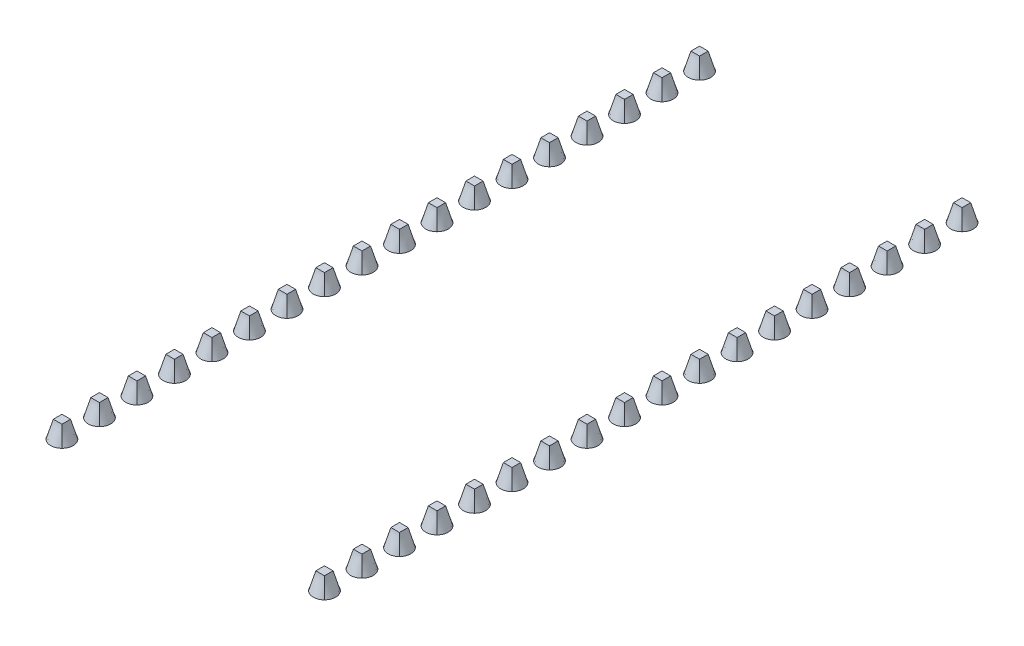
from build123d import *


with BuildPart() as part:
    # Sketch1 for Loft1 → Loft1 section 0
    with BuildSketch(Plane(origin=(0, 0, 0), x_dir=(1, 0, 0), z_dir=(0, 1, 0))):
        with BuildLine():
            # circular arc as an exact rational Bezier (weights 1, cos(half-angle), 1)
            Bezier((-8.351184633, -21.051184633), (-8.89, -20.512369265), (-9.428815367, -21.051184633), weights=[1, 0.70710678, 1])
            Bezier((-9.428815367, -21.051184633), (-9.967630735, -21.59), (-9.428815367, -22.128815367), weights=[1, 0.70710678, 1])
            Bezier((-9.428815367, -22.128815367), (-8.89, -22.667630735), (-8.351184633, -22.128815367), weights=[1, 0.70710678, 1])
            Bezier((-8.351184633, -22.128815367), (-7.812369265, -21.59), (-8.351184633, -21.051184633), weights=[1, 0.70710678, 1])
        make_face()
    # Sketch2 → Loft1 section 1
    with BuildSketch(Plane(origin=(0, 1.1684, 0), x_dir=(1, 0, 0), z_dir=(0, 1, 0))):
        with BuildLine():
            Line((-8.5979, -21.2979), (-9.1821, -21.2979))
            Line((-9.1821, -21.2979), (-9.1821, -21.8821))
            Line((-9.1821, -21.8821), (-8.5979, -21.8821))
            Line((-8.5979, -21.8821), (-8.5979, -21.2979))
        make_face()
    loft()


with BuildPart() as body_2:
    # LPattern2: read off the stored shape, not the designer's step
    # LPattern2: copy of part
    add(part.part.moved(Location((17.78, 0, -43.18))))


with BuildPart() as body_3:
    # LPattern2 2: copy of part
    add(part.part.moved(Location((17.78, 0, -40.64))))


with BuildPart() as body_4:
    # LPattern2 3: copy of part
    add(part.part.moved(Location((17.78, 0, -38.1))))


with BuildPart() as body_5:
    # LPattern2 4: copy of part
    add(part.part.moved(Location((17.78, 0, -35.56))))


with BuildPart() as body_6:
    # LPattern2 5: copy of part
    add(part.part.moved(Location((17.78, 0, -33.02))))


with BuildPart() as body_7:
    # LPattern2 6: copy of part
    add(part.part.moved(Location((17.78, 0, -30.48))))


with BuildPart() as body_8:
    # LPattern2 7: copy of part
    add(part.part.moved(Location((17.78, 0, -27.94))))


with BuildPart() as body_9:
    # LPattern2 8: copy of part
    add(part.part.moved(Location((17.78, 0, -25.4))))


with BuildPart() as body_10:
    # LPattern2 9: copy of part
    add(part.part.moved(Location((17.78, 0, -22.86))))


with BuildPart() as body_11:
    # LPattern2 10: copy of part
    add(part.part.moved(Location((17.78, 0, -20.32))))


with BuildPart() as body_12:
    # LPattern2 11: copy of part
    add(part.part.moved(Location((17.78, 0, -17.78))))


with BuildPart() as body_13:
    # LPattern2 12: copy of part
    add(part.part.moved(Location((17.78, 0, -15.24))))


with BuildPart() as body_14:
    # LPattern2 13: copy of part
    add(part.part.moved(Location((17.78, 0, -12.7))))


with BuildPart() as body_15:
    # LPattern2 14: copy of part
    add(part.part.moved(Location((17.78, 0, -10.16))))


with BuildPart() as body_16:
    # LPattern2 15: copy of part
    add(part.part.moved(Location((17.78, 0, -7.62))))


with BuildPart() as body_17:
    # LPattern2 16: copy of part
    add(part.part.moved(Location((17.78, 0, -5.08))))


with BuildPart() as body_18:
    # LPattern2 17: copy of part
    add(part.part.moved(Location((17.78, 0, -2.54))))


with BuildPart() as body_19:
    # LPattern2 18: copy of part
    add(part.part.moved(Location((17.78, 0, 0))))


with BuildPart() as body_20:
    # LPattern2 19: copy of part
    add(part.part.moved(Location((0, 0, -43.18))))


with BuildPart() as body_21:
    # LPattern2 20: copy of part
    add(part.part.moved(Location((0, 0, -40.64))))


with BuildPart() as body_22:
    # LPattern2 21: copy of part
    add(part.part.moved(Location((0, 0, -38.1))))


with BuildPart() as body_23:
    # LPattern2 22: copy of part
    add(part.part.moved(Location((0, 0, -35.56))))


with BuildPart() as body_24:
    # LPattern2 23: copy of part
    add(part.part.moved(Location((0, 0, -33.02))))


with BuildPart() as body_25:
    # LPattern2 24: copy of part
    add(part.part.moved(Location((0, 0, -30.48))))


with BuildPart() as body_26:
    # LPattern2 25: copy of part
    add(part.part.moved(Location((0, 0, -27.94))))


with BuildPart() as body_27:
    # LPattern2 26: copy of part
    add(part.part.moved(Location((0, 0, -25.4))))


with BuildPart() as body_28:
    # LPattern2 27: copy of part
    add(part.part.moved(Location((0, 0, -22.86))))


with BuildPart() as body_29:
    # LPattern2 28: copy of part
    add(part.part.moved(Location((0, 0, -20.32))))


with BuildPart() as body_30:
    # LPattern2 29: copy of part
    add(part.part.moved(Location((0, 0, -17.78))))


with BuildPart() as body_31:
    # LPattern2 30: copy of part
    add(part.part.moved(Location((0, 0, -15.24))))


with BuildPart() as body_32:
    # LPattern2 31: copy of part
    add(part.part.moved(Location((0, 0, -12.7))))


with BuildPart() as body_33:
    # LPattern2 32: copy of part
    add(part.part.moved(Location((0, 0, -10.16))))


with BuildPart() as body_34:
    # LPattern2 33: copy of part
    add(part.part.moved(Location((0, 0, -7.62))))


with BuildPart() as body_35:
    # LPattern2 34: copy of part
    add(part.part.moved(Location((0, 0, -5.08))))


with BuildPart() as body_36:
    # LPattern2 35: copy of part
    add(part.part.moved(Location((0, 0, -2.54))))


solid = Compound([part.part, body_2.part, body_3.part, body_4.part, body_5.part, body_6.part, body_7.part, body_8.part, body_9.part, body_10.part, body_11.part, body_12.part, body_13.part, body_14.part, body_15.part, body_16.part, body_17.part, body_18.part, body_19.part, body_20.part, body_21.part, body_22.part, body_23.part, body_24.part, body_25.part, body_26.part, body_27.part, body_28.part, body_29.part, body_30.part, body_31.part, body_32.part, body_33.part, body_34.part, body_35.part, body_36.part])
